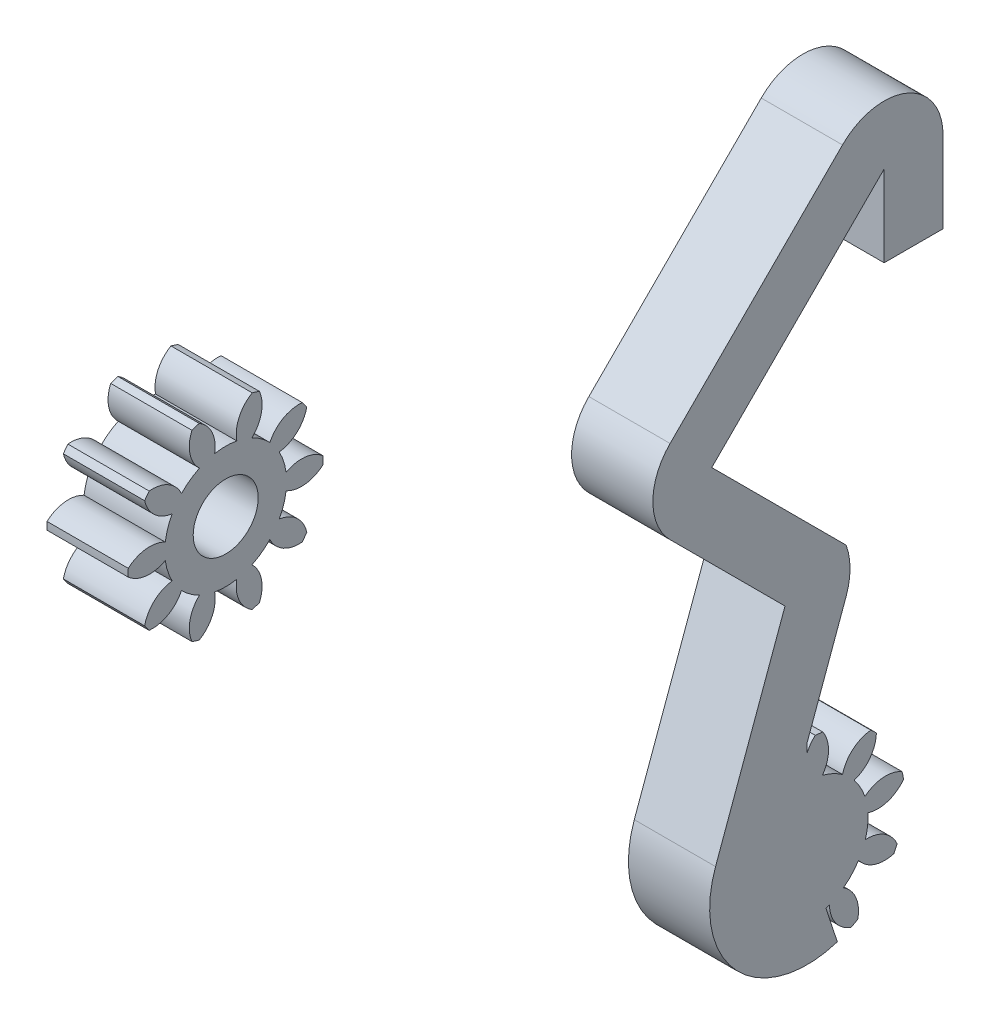
from build123d import *

# Parameters (mm, degrees)
SPUR_START             = -35.779405604
SPUR_GEAR_AM_OUTLINE_R = 2
SPUR_GEAR_AM_DEPTH     = 5
BOSS_EXTRUDE1_DEPTH    = 5
CUT_EXTRUDE1_START     = -5
SKETCH2_R              = 2
CUT_EXTRUDE1_DEPTH     = 5
BOSS_EXTRUDE4_START    = -5
BOSS_EXTRUDE4_DEPTH    = 5


# Read off the part's stored shape, not the designer's step: spur gear_am
with BuildPart() as part:
    # spur gear_am outline → spur gear_am (new body)
    with BuildSketch(Plane.YZ.offset(SPUR_START)):
        with BuildLine():
            ThreePointArc((6.035064372, -3.475290544), (6.269831909, -3.479885286), (6.504599445, -3.475290544))
            ThreePointArc((6.504599445, -3.475290544), (6.992060826, -2.376369483), (6.761446014, -1.196512329))
            ThreePointArc((6.761446014, -1.196512329), (7.42833662, -1.045396166), (8.056686306, -0.775663247))
            ThreePointArc((8.056686306, -0.775663247), (8.56361764, -1.865739721), (9.603911774, -2.468262924))
            ThreePointArc((9.603911774, -2.468262924), (9.796543422, -2.333987253), (9.983773627, -2.192277133))
            ThreePointArc((9.983773627, -2.192277133), (9.732208576, -1.016708708), (8.852134639, -0.197736204))
            ThreePointArc((8.852134639, -0.197736204), (9.302836621, 0.316507803), (9.652637162, 0.904060997))
            ThreePointArc((9.652637162, 0.904060997), (10.703484101, 0.320137366), (11.899253988, 0.444155406))
            ThreePointArc((11.899253988, 0.444155406), (11.976171006, 0.666012748), (12.044348305, 0.890709796))
            ThreePointArc((12.044348305, 0.890709796), (11.14984612, 1.693898402), (9.956471389, 1.839166595))
            ThreePointArc((9.956471389, 1.839166595), (10.018831909, 2.520114714), (9.956471389, 3.201062833))
            ThreePointArc((9.956471389, 3.201062833), (11.14984612, 3.346331025), (12.044348305, 4.149519631))
            ThreePointArc((12.044348305, 4.149519631), (11.976171006, 4.37421668), (11.899253988, 4.596074022))
            ThreePointArc((11.899253988, 4.596074022), (10.703484101, 4.720092061), (9.652637162, 4.13616843))
            ThreePointArc((9.652637162, 4.13616843), (9.302836621, 4.723721624), (8.852134639, 5.237965631))
            ThreePointArc((8.852134639, 5.237965631), (9.732208576, 6.056938135), (9.983773627, 7.23250656))
            ThreePointArc((9.983773627, 7.23250656), (9.796543422, 7.37421668), (9.603911774, 7.508492351))
            ThreePointArc((9.603911774, 7.508492351), (8.56361764, 6.905969148), (8.056686306, 5.815892674))
            ThreePointArc((8.056686306, 5.815892674), (7.42833662, 6.085625593), (6.761446014, 6.236741756))
            ThreePointArc((6.761446014, 6.236741756), (6.992060826, 7.41659891), (6.504599445, 8.515519971))
            ThreePointArc((6.504599445, 8.515519971), (6.269831909, 8.520114714), (6.035064372, 8.515519971))
            ThreePointArc((6.035064372, 8.515519971), (5.547602991, 7.41659891), (5.778217803, 6.236741756))
            ThreePointArc((5.778217803, 6.236741756), (5.111327197, 6.085625593), (4.482977511, 5.815892674))
            ThreePointArc((4.482977511, 5.815892674), (3.976046178, 6.905969148), (2.935752043, 7.508492351))
            ThreePointArc((2.935752043, 7.508492351), (2.743120395, 7.37421668), (2.55589019, 7.23250656))
            ThreePointArc((2.55589019, 7.23250656), (2.807455242, 6.056938135), (3.687529179, 5.237965631))
            ThreePointArc((3.687529179, 5.237965631), (3.236827197, 4.723721624), (2.887026655, 4.13616843))
            ThreePointArc((2.887026655, 4.13616843), (1.836179716, 4.720092061), (0.640409829, 4.596074022))
            ThreePointArc((0.640409829, 4.596074022), (0.563492811, 4.37421668), (0.495315512, 4.149519631))
            ThreePointArc((0.495315512, 4.149519631), (1.389817697, 3.346331025), (2.583192428, 3.201062833))
            ThreePointArc((2.583192428, 3.201062833), (2.520831909, 2.520114714), (2.583192428, 1.839166595))
            ThreePointArc((2.583192428, 1.839166595), (1.389817697, 1.693898402), (0.495315512, 0.890709796))
            ThreePointArc((0.495315512, 0.890709796), (0.563492811, 0.666012748), (0.640409829, 0.444155406))
            ThreePointArc((0.640409829, 0.444155406), (1.836179716, 0.320137366), (2.887026655, 0.904060997))
            ThreePointArc((2.887026655, 0.904060997), (3.236827197, 0.316507803), (3.687529179, -0.197736204))
            ThreePointArc((3.687529179, -0.197736204), (2.807455242, -1.016708708), (2.55589019, -2.192277133))
            ThreePointArc((2.55589019, -2.192277133), (2.743120395, -2.333987253), (2.935752043, -2.468262924))
            ThreePointArc((2.935752043, -2.468262924), (3.976046178, -1.865739721), (4.482977511, -0.775663247))
            ThreePointArc((4.482977511, -0.775663247), (5.111327197, -1.045396166), (5.778217803, -1.196512329))
            ThreePointArc((5.778217803, -1.196512329), (5.547602991, -2.376369483), (6.035064372, -3.475290544))
        make_face()
        with Locations((6.269831909, 2.520114714)):
            Circle(SPUR_GEAR_AM_OUTLINE_R, mode=Mode.SUBTRACT)
    extrude(amount=SPUR_GEAR_AM_DEPTH)


with BuildPart() as body_2:
    # Sketch1 → Boss-Extrude1 (new body)
    with BuildSketch(Plane(origin=(0, 0, 0), x_dir=(0, 0, -1), z_dir=(1, 0, 0))):
        with BuildLine():
            Line((-2.520114714, 12.117440709), (-2.520114714, 6.269831909))
            Line((-2.520114714, 6.269831909), (-0.666012747, 0.563492811))
            ThreePointArc((-0.666012747, 0.563492811), (-6.836153516, 2.101881686), (-8.158270438, 8.321952769))
            Line((-8.158270438, 8.321952769), (-3.883018647, 20.068110528))
            Line((-3.883018647, 20.068110528), (-10.954086459, 27.13917834))
            ThreePointArc((-10.954086459, 27.13917834), (-12.015892078, 29.702603869), (-10.954086459, 32.266029397))
            Line((-10.954086459, 32.266029397), (-0.347484741, 42.872631115))
            ThreePointArc((-0.347484741, 42.872631115), (3.603256686, 43.658482445), (5.841171936, 40.309205586))
            Line((5.841171936, 40.309205586), (5.841171936, 35.309205586))
            Line((5.841171936, 35.309205586), (2.215940787, 35.309205586))
            Line((2.215940787, 35.309205586), (2.215940787, 40.309205586))
            Line((2.215940787, 40.309205586), (-8.39066093, 29.702603869))
            Line((-8.39066093, 29.702603869), (-0.124248164, 21.436191102))
            ThreePointArc((-0.124248164, 21.436191102), (0.116981353, 20.068110528), (-0.124248164, 18.700029955))
            Line((-0.124248164, 18.700029955), (-2.520114714, 12.117440709))
        make_face()
    extrude(amount=BOSS_EXTRUDE1_DEPTH)

    # Sketch2 → Cut-Extrude1 (cut)
    with BuildSketch(Plane(origin=(5, 0, 0), x_dir=(0, 0, -1), z_dir=(1, 0, 0)).offset(CUT_EXTRUDE1_START)):
        with Locations(Location((-2.520114714, 6.269831909, 0), (0, 0, 180))):
            Circle(SKETCH2_R)
    extrude(amount=CUT_EXTRUDE1_DEPTH, mode=Mode.SUBTRACT)

    # Sketch5 → Boss-Extrude4 (add)
    with BuildSketch(Plane(origin=(5, 0, 0), x_dir=(0, 0, -1), z_dir=(1, 0, 0)).offset(BOSS_EXTRUDE4_START)):
        with BuildLine():
            ThreePointArc((3.320342305, 7.644263358), (2.148599503, 7.913084677), (1.034423028, 7.461579551))
            ThreePointArc((1.034423028, 7.461579551), (0.758834569, 8.087383175), (0.37416263, 8.65272084))
            ThreePointArc((0.37416263, 8.65272084), (1.347484271, 9.358334814), (1.740439947, 10.494482662))
            ThreePointArc((1.740439947, 10.494482662), (1.571875447, 10.657954118), (1.397043733, 10.814704811))
            ThreePointArc((1.397043733, 10.814704811), (0.291074687, 10.343452688), (-0.344924962, 9.323280867))
            ThreePointArc((-0.344924962, 9.323280867), (-0.93571885, 9.667579802), (-1.579222127, 9.898843088))
            ThreePointArc((-1.579222127, 9.898843088), (-1.206537867, 11.041800891), (-1.556440997, 12.191937359))
            ThreePointArc((-1.556440997, 12.191937359), (-1.788898653, 12.225108819), (-2.022476226, 12.24915929))
            ThreePointArc((-2.022476226, 12.24915929), (-2.640228932, 11.217836019), (-2.555121505, 10.018668465))
            ThreePointArc((-2.555121505, 10.018668465), (-3.235457637, 9.949952219), (-3.891995873, 9.758806412))
            ThreePointArc((-3.891995873, 9.758806412), (-4.262301713, 10.90253701), (-5.221412546, 11.627349059))
            ThreePointArc((-5.221412546, 11.627349059), (-5.428972435, 11.517550152), (-5.632077174, 11.399713939))
            ThreePointArc((-5.632077174, 11.399713939), (-5.525653002, 10.202249956), (-4.751946644, 9.282127916))
            ThreePointArc((-4.751946644, 9.282127916), (-5.261959741, 8.826643761), (-5.680757645, 8.286100061))
            ThreePointArc((-5.680757645, 8.286100061), (-6.65260934, 8.99373724), (-7.854580137, 9.016371303))
            ThreePointArc((-7.854580137, 9.016371303), (-7.957961436, 8.805541479), (-8.053014233, 8.590828011))
            ThreePointArc((-8.053014233, 8.590828011), (-7.2630636, 7.684613857), (-6.096287842, 7.394992676))
            ThreePointArc((-6.096287842, 7.394992676), (-6.241170236, 6.726720077), (-6.262261243, 6.043247807))
            ThreePointArc((-6.262261243, 6.043247807), (-7.464444479, 6.044498216), (-8.450163248, 5.35630885))
            ThreePointArc((-8.450163248, 5.35630885), (-8.409877814, 5.124977936), (-8.360571733, 4.895400459))
            ThreePointArc((-8.360571733, 4.895400459), (-7.18882893, 4.62657914), (-6.074652455, 5.078084267))
            ThreePointArc((-6.074652455, 5.078084267), (-5.799063996, 4.452280642), (-5.414392057, 3.886942978))
            ThreePointArc((-5.414392057, 3.886942978), (-6.387713698, 3.181329004), (-6.780669374, 2.045181156))
            ThreePointArc((-6.780669374, 2.045181156), (-6.612104874, 1.881709699), (-6.43727316, 1.724959006))
            ThreePointArc((-6.43727316, 1.724959006), (-5.331304114, 2.196211129), (-4.695304465, 3.21638295))
            ThreePointArc((-4.695304465, 3.21638295), (-4.104510577, 2.872084015), (-3.4610073, 2.640820729))
            ThreePointArc((-3.4610073, 2.640820729), (-3.83369156, 1.497862927), (-3.48378843, 0.347726458))
            ThreePointArc((-3.48378843, 0.347726458), (-3.251330774, 0.314554999), (-3.017753201, 0.290504527))
            ThreePointArc((-3.017753201, 0.290504527), (-2.400000495, 1.321827799), (-2.485107922, 2.520995353))
            ThreePointArc((-2.485107922, 2.520995353), (-1.80477179, 2.589711598), (-1.148233554, 2.780857406))
            ThreePointArc((-1.148233554, 2.780857406), (-0.777927714, 1.637126807), (0.181183119, 0.912314758))
            ThreePointArc((0.181183119, 0.912314758), (0.388743008, 1.022113666), (0.591847747, 1.139949878))
            ThreePointArc((0.591847747, 1.139949878), (0.485423575, 2.337413862), (-0.288282783, 3.257535901))
            ThreePointArc((-0.288282783, 3.257535901), (0.221730314, 3.713020057), (0.640528217, 4.253563756))
            ThreePointArc((0.640528217, 4.253563756), (1.612379913, 3.545926577), (2.81435071, 3.523292514))
            ThreePointArc((2.81435071, 3.523292514), (2.917732009, 3.734122338), (3.012784806, 3.948835807))
            ThreePointArc((3.012784806, 3.948835807), (2.222834173, 4.855049961), (1.056058415, 5.144671141))
            ThreePointArc((1.056058415, 5.144671141), (1.200940809, 5.81294374), (1.222031815, 6.496416011))
            ThreePointArc((1.222031815, 6.496416011), (2.424215051, 6.495165601), (3.409933821, 7.183354967))
            ThreePointArc((3.409933821, 7.183354967), (3.369648387, 7.414685881), (3.320342305, 7.644263358))
        make_face()
    extrude(amount=BOSS_EXTRUDE4_DEPTH)


solid = Compound([part.part, body_2.part])
